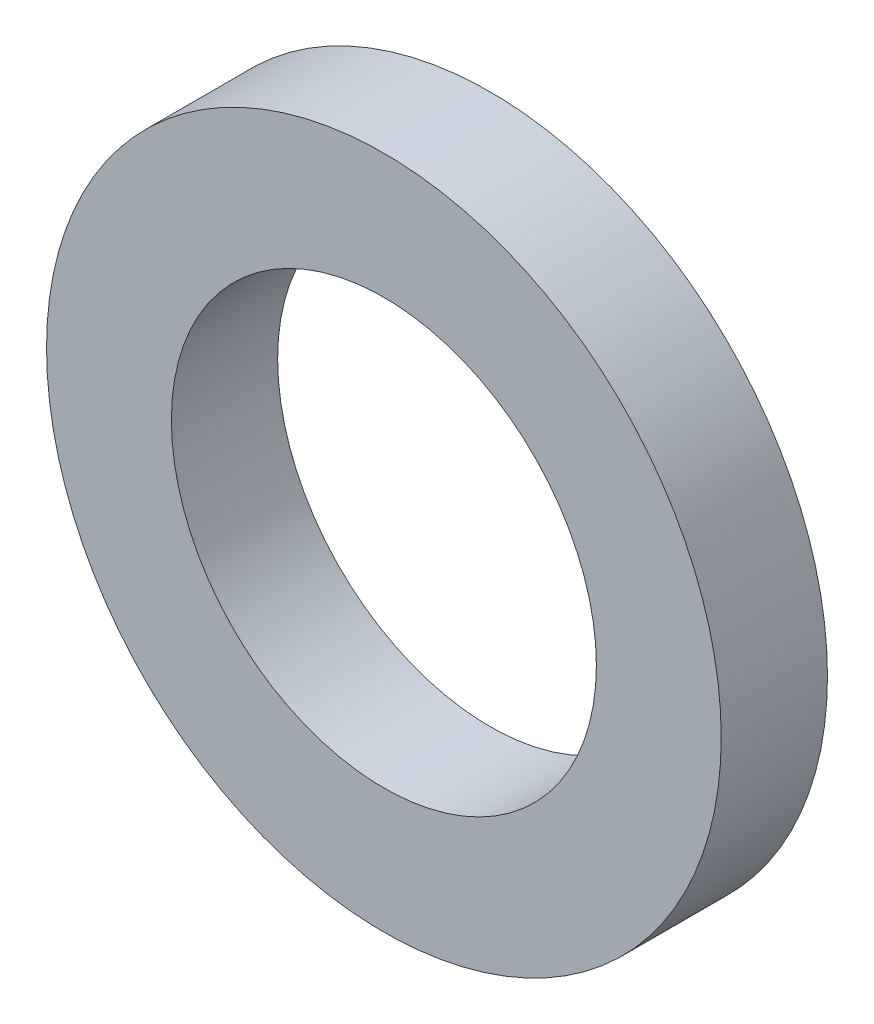
from build123d import *

# Parameters (mm, degrees)
SKETCH1_R           = 6.35
SKETCH1_R_2         = 4
BOSS_EXTRUDE1_DEPTH = 2


with BuildPart() as part:
    # Sketch1 → Boss-Extrude1 (new body)
    with BuildSketch(Plane(origin=(0, 0, 0), x_dir=(0, 1, 0), z_dir=(0, 0, 1))):
        Circle(SKETCH1_R)
        Circle(SKETCH1_R_2, mode=Mode.SUBTRACT)
    extrude(amount=BOSS_EXTRUDE1_DEPTH)


solid = part.part
